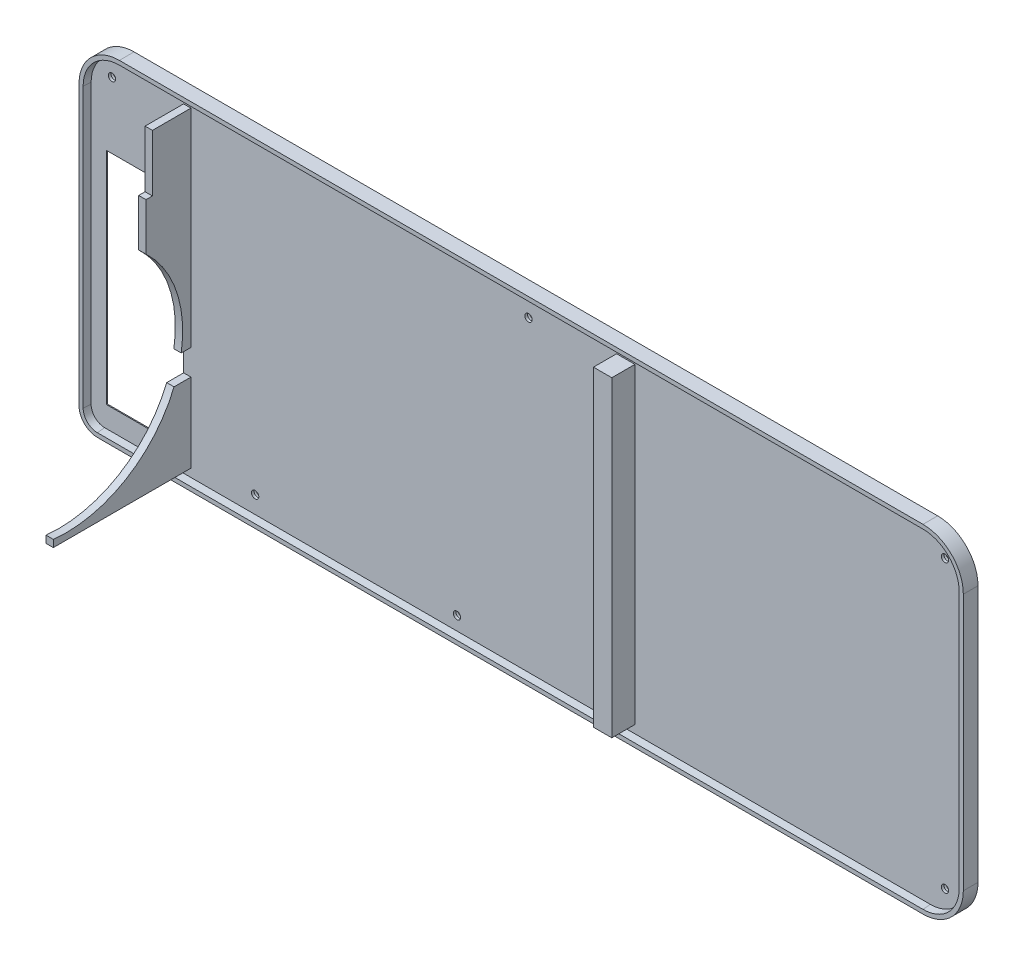
from build123d import *

# Parameters (mm, degrees)
SKETCH_1_W          = 241
SKETCH_1_H          = 92
EXTRUDE_1_DEPTH     = 2
FILLET_1_R          = 5
FILLET_2_R          = 11
CUT_EXTRUDE_1_REACH = 130.997
SKETCH_3_R          = 1
SKETCH_4_R          = 2
CUT_EXTRUDE_2_DEPTH = 1.3
EXTRUDE_START       = 2
EXTRUDE_2_DEPTH     = 2
CHAMFER_1_SIZE      = 0.174977327
CHAMFER_1_SIZE_2    = 2
SKETCH_6_W          = 5
SKETCH_6_H          = 85
EXTRUDE_3_DEPTH     = 6.3
CUT_EXTRUDE_3_REACH = 131.135
SKETCH_7_W          = 21
SKETCH_7_H          = 60
EXTRUDE_START_2     = -28.5
EXTRUDE_4_DEPTH     = 2
CHAMFER_2_SIZE      = 3
CHAMFER_2_SIZE2     = 1.732050808


with BuildPart() as part:
    # 草图1 → 凸台-拉伸1 (new body)
    with BuildSketch(Plane.XY):
        Rectangle(SKETCH_1_W, SKETCH_1_H)
    extrude(amount=EXTRUDE_1_DEPTH)

    # 圆角1
    fillet_1_edges = [part.edges().sort_by_distance(p)[0] for p in [
        (-120.5, -46, 1),
    ]]
    fillet(fillet_1_edges, radius=FILLET_1_R)

    # 圆角2
    fillet_2_edges = [part.edges().sort_by_distance(p)[0] for p in [
        (120.5, -46, 1),
        (-120.5, 46, 1),
        (120.5, 46, 1),
    ]]
    fillet(fillet_2_edges, radius=FILLET_2_R)

    # 草图3 → 切除-拉伸1 (cut, up to next)
    with BuildSketch(Plane.XY.offset(2), mode=Mode.PRIVATE) as cut_extrude_1_sk1:
        with Locations((-19.5, -41)):
            Circle(SKETCH_3_R)
    cut_extrude_1_tool1 = extrude(cut_extrude_1_sk1.sketch, amount=-CUT_EXTRUDE_1_REACH, mode=Mode.PRIVATE) & part.part
    # 草图3 → 切除-拉伸1 (cut, up to next)
    with BuildSketch(Plane.XY.offset(2), mode=Mode.PRIVATE) as cut_extrude_1_sk2:
        with Locations((-74.5, -40)):
            Circle(SKETCH_3_R)
    cut_extrude_1_tool2 = extrude(cut_extrude_1_sk2.sketch, amount=-CUT_EXTRUDE_1_REACH, mode=Mode.PRIVATE) & part.part
    # 草图3 → 切除-拉伸1 (cut, up to next)
    with BuildSketch(Plane.XY.offset(2), mode=Mode.PRIVATE) as cut_extrude_1_sk3:
        with Locations((-113.5, 39)):
            Circle(SKETCH_3_R)
    cut_extrude_1_tool3 = extrude(cut_extrude_1_sk3.sketch, amount=-CUT_EXTRUDE_1_REACH, mode=Mode.PRIVATE) & part.part
    # 草图3 → 切除-拉伸1 (cut, up to next)
    with BuildSketch(Plane.XY.offset(2), mode=Mode.PRIVATE) as cut_extrude_1_sk4:
        with Locations((0, 39)):
            Circle(SKETCH_3_R)
    cut_extrude_1_tool4 = extrude(cut_extrude_1_sk4.sketch, amount=-CUT_EXTRUDE_1_REACH, mode=Mode.PRIVATE) & part.part
    # 草图3 → 切除-拉伸1 (cut, up to next)
    with BuildSketch(Plane.XY.offset(2), mode=Mode.PRIVATE) as cut_extrude_1_sk5:
        with Locations((113.5, -39)):
            Circle(SKETCH_3_R)
    cut_extrude_1_tool5 = extrude(cut_extrude_1_sk5.sketch, amount=-CUT_EXTRUDE_1_REACH, mode=Mode.PRIVATE) & part.part
    # 草图3 → 切除-拉伸1 (cut, up to next)
    with BuildSketch(Plane.XY.offset(2), mode=Mode.PRIVATE) as cut_extrude_1_sk6:
        with Locations((113.5, 39)):
            Circle(SKETCH_3_R)
    cut_extrude_1_tool6 = extrude(cut_extrude_1_sk6.sketch, amount=-CUT_EXTRUDE_1_REACH, mode=Mode.PRIVATE) & part.part
    add(cut_extrude_1_tool1.solids().sort_by_distance((-19.5, -41, 2))[0], mode=Mode.SUBTRACT)
    add(cut_extrude_1_tool2.solids().sort_by_distance((-74.5, -40, 2))[0], mode=Mode.SUBTRACT)
    add(cut_extrude_1_tool3.solids().sort_by_distance((-113.5, 39, 2))[0], mode=Mode.SUBTRACT)
    add(cut_extrude_1_tool4.solids().sort_by_distance((0, 39, 2))[0], mode=Mode.SUBTRACT)
    add(cut_extrude_1_tool5.solids().sort_by_distance((113.5, -39, 2))[0], mode=Mode.SUBTRACT)
    add(cut_extrude_1_tool6.solids().sort_by_distance((113.5, 39, 2))[0], mode=Mode.SUBTRACT)

    # 草图4 → 切除-拉伸2 (cut)
    with BuildSketch(Plane(origin=(0, 0, 0), x_dir=(-1, 0, 0), z_dir=(0, 0, -1))):
        with Locations((74.5, -40)):
            Circle(SKETCH_4_R)
        with Locations((19.5, -41)):
            Circle(SKETCH_4_R)
        with Locations((-113.5, -39)):
            Circle(SKETCH_4_R)
        with Locations((-113.5, 39)):
            Circle(SKETCH_4_R)
        with Locations((0, 39)):
            Circle(SKETCH_4_R)
        with Locations((113.5, 39)):
            Circle(SKETCH_4_R)
    extrude(amount=-CUT_EXTRUDE_2_DEPTH, mode=Mode.SUBTRACT)

    # 草图5 → 凸台-拉伸2 (add)
    with BuildSketch(Plane.XY.offset(2).offset(EXTRUDE_START)):
        with BuildLine():
            ThreePointArc((-120.5, -41), (-119.035533906, -44.535533906), (-115.5, -46))
            Line((-115.5, -46), (109.5, -46))
            ThreePointArc((109.5, -46), (117.278174593, -42.778174593), (120.5, -35))
            Line((120.5, -35), (120.5, 35))
            ThreePointArc((120.5, 35), (117.278174593, 42.778174593), (109.5, 46))
            Line((109.5, 46), (-109.5, 46))
            ThreePointArc((-109.5, 46), (-117.278174593, 42.778174593), (-120.5, 35))
            Line((-120.5, 35), (-120.5, -41))
        make_face()
        with BuildLine():
            Line((109.5, -44.7), (-115.5, -44.7))
            ThreePointArc((-115.5, -44.7), (-118.11629509, -43.61629509), (-119.2, -41))
            Line((-119.2, -41), (-119.2, 35))
            ThreePointArc((-119.2, 35), (-116.358935778, 41.858935778), (-109.5, 44.7))
            Line((-109.5, 44.7), (109.5, 44.7))
            ThreePointArc((109.5, 44.7), (116.358935778, 41.858935778), (119.2, 35))
            Line((119.2, 35), (119.2, -35))
            ThreePointArc((119.2, -35), (116.358935778, -41.858935778), (109.5, -44.7))
        make_face(mode=Mode.SUBTRACT)
    extrude(amount=-EXTRUDE_2_DEPTH)

    # 倒角1
    # the kernel refuses this chamfer: 2, 0.174977327 mm, written as the material it takes off along each edge
    with BuildSketch(Plane(origin=(-109.5, 44.7, 4), x_dir=(0, 0.9159861691531133, 0.40120984275090293), z_dir=(1, 0, 0))) as chamfer_1_piece_1_section:
        Polygon((CHAMFER_1_SIZE * 0.915986169425, -CHAMFER_1_SIZE * 0.40120984287), (-CHAMFER_1_SIZE_2 * 0.401209842751, -CHAMFER_1_SIZE_2 * 0.915986169153), (0, 0), align=None)
    chamfer_1_piece_1 = extrude(amount=219, mode=Mode.PRIVATE)
    chamfer_1_piece_1 = split(chamfer_1_piece_1, bisect_by=Plane(origin=(0, 44.735649873, 2), z_dir=(0, 0, 1)), keep=Keep.TOP, mode=Mode.PRIVATE)
    add(chamfer_1_piece_1, mode=Mode.SUBTRACT)
    with BuildSketch(Plane(origin=(109.5, 35, 4), x_dir=(0, 1, 0), z_dir=(-1, 0, 0))) as chamfer_1_piece_2_section:
        Polygon((9.7 + CHAMFER_1_SIZE, 0), (9.7, CHAMFER_1_SIZE_2), (9.7, 0), align=None)
    chamfer_1_piece_2 = revolve(axis=Axis((109.5, 35, 4), (0, 0, -1)), revolution_arc=90, mode=Mode.PRIVATE)
    chamfer_1_piece_2 = split(chamfer_1_piece_2, bisect_by=Plane(origin=(116.41200817, 41.91200817, 2), z_dir=(0, 0, 1)), keep=Keep.TOP, mode=Mode.PRIVATE)
    add(chamfer_1_piece_2, mode=Mode.SUBTRACT)
    with BuildSketch(Plane(origin=(-109.5, 35, 4), x_dir=(-1, 0, 0), z_dir=(0, -1, 0))) as chamfer_1_piece_3_section:
        Polygon((9.7 + CHAMFER_1_SIZE, 0), (9.7, CHAMFER_1_SIZE_2), (9.7, 0), align=None)
    chamfer_1_piece_3 = revolve(axis=Axis((-109.5, 35, 4), (0, 0, -1)), revolution_arc=90, mode=Mode.PRIVATE)
    chamfer_1_piece_3 = split(chamfer_1_piece_3, bisect_by=Plane(origin=(-116.412008168, 41.912008168, 2), z_dir=(0, 0, 1)), keep=Keep.TOP, mode=Mode.PRIVATE)
    add(chamfer_1_piece_3, mode=Mode.SUBTRACT)
    with BuildSketch(Plane(origin=(119.2, 35, 4), x_dir=(0.9159861691531133, 0, 0.40120984275090293), z_dir=(0, -1, 0))) as chamfer_1_piece_4_section:
        Polygon((CHAMFER_1_SIZE * 0.915986169425, -CHAMFER_1_SIZE * 0.40120984287), (-CHAMFER_1_SIZE_2 * 0.401209842751, -CHAMFER_1_SIZE_2 * 0.915986169153), (0, 0), align=None)
    chamfer_1_piece_4 = extrude(amount=70, mode=Mode.PRIVATE)
    chamfer_1_piece_4 = split(chamfer_1_piece_4, bisect_by=Plane(origin=(119.235649873, 0, 2), z_dir=(0, 0, 1)), keep=Keep.TOP, mode=Mode.PRIVATE)
    add(chamfer_1_piece_4, mode=Mode.SUBTRACT)
    with BuildSketch(Plane(origin=(-119.2, -41, 4), x_dir=(-0.9159861691531133, 0, 0.40120984275090293), z_dir=(0, 1, 0))) as chamfer_1_piece_5_section:
        Polygon((CHAMFER_1_SIZE * 0.915986169425, -CHAMFER_1_SIZE * 0.40120984287), (-CHAMFER_1_SIZE_2 * 0.401209842751, -CHAMFER_1_SIZE_2 * 0.915986169153), (0, 0), align=None)
    chamfer_1_piece_5 = extrude(amount=76, mode=Mode.PRIVATE)
    chamfer_1_piece_5 = split(chamfer_1_piece_5, bisect_by=Plane(origin=(-119.235649873, -3, 2), z_dir=(0, 0, 1)), keep=Keep.TOP, mode=Mode.PRIVATE)
    add(chamfer_1_piece_5, mode=Mode.SUBTRACT)
    with BuildSketch(Plane(origin=(109.5, -35, 4), x_dir=(1, 0, 0), z_dir=(0, 1, 0))) as chamfer_1_piece_6_section:
        Polygon((9.7 + CHAMFER_1_SIZE, 0), (9.7, CHAMFER_1_SIZE_2), (9.7, 0), align=None)
    chamfer_1_piece_6 = revolve(axis=Axis((109.5, -35, 4), (0, 0, -1)), revolution_arc=90, mode=Mode.PRIVATE)
    chamfer_1_piece_6 = split(chamfer_1_piece_6, bisect_by=Plane(origin=(116.41200817, -41.91200817, 2), z_dir=(0, 0, 1)), keep=Keep.TOP, mode=Mode.PRIVATE)
    add(chamfer_1_piece_6, mode=Mode.SUBTRACT)
    with BuildSketch(Plane(origin=(-115.5, -41, 4), x_dir=(0, -1, 0), z_dir=(1, 0, 0))) as chamfer_1_piece_7_section:
        Polygon((3.7 + CHAMFER_1_SIZE, 0), (3.7, CHAMFER_1_SIZE_2), (3.7, 0), align=None)
    chamfer_1_piece_7 = revolve(axis=Axis((-115.5, -41, 4), (0, 0, -1)), revolution_arc=90, mode=Mode.PRIVATE)
    chamfer_1_piece_7 = split(chamfer_1_piece_7, bisect_by=Plane(origin=(-118.172444307, -43.672444307, 2), z_dir=(0, 0, 1)), keep=Keep.TOP, mode=Mode.PRIVATE)
    add(chamfer_1_piece_7, mode=Mode.SUBTRACT)
    with BuildSketch(Plane(origin=(109.5, -44.7, 4), x_dir=(0, -0.9159861691531133, 0.40120984275090293), z_dir=(-1, 0, 0))) as chamfer_1_piece_8_section:
        Polygon((CHAMFER_1_SIZE * 0.915986169425, -CHAMFER_1_SIZE * 0.40120984287), (-CHAMFER_1_SIZE_2 * 0.401209842751, -CHAMFER_1_SIZE_2 * 0.915986169153), (0, 0), align=None)
    chamfer_1_piece_8 = extrude(amount=225, mode=Mode.PRIVATE)
    chamfer_1_piece_8 = split(chamfer_1_piece_8, bisect_by=Plane(origin=(-3, -44.735649873, 2), z_dir=(0, 0, 1)), keep=Keep.TOP, mode=Mode.PRIVATE)
    add(chamfer_1_piece_8, mode=Mode.SUBTRACT)

    # 草图6 → 凸台-拉伸3 (add)
    with BuildSketch(Plane.XY.offset(2)):
        with Locations((26.5, 0)):
            Rectangle(SKETCH_6_W, SKETCH_6_H)
    extrude(amount=EXTRUDE_3_DEPTH)

    # 草图7 → 切除-拉伸3 (cut, up to next)
    with BuildSketch(Plane.XY.offset(2), mode=Mode.PRIVATE) as cut_extrude_3_sk1:
        with Locations((-104.5, -9)):
            Rectangle(SKETCH_7_W, SKETCH_7_H)
    cut_extrude_3_tool1 = extrude(cut_extrude_3_sk1.sketch, amount=-CUT_EXTRUDE_3_REACH, mode=Mode.PRIVATE) & part.part
    add(cut_extrude_3_tool1.solids().sort_by_distance((-104.5, -9, 2))[0], mode=Mode.SUBTRACT)

    # 草图8 → 凸台-拉伸4 (add)
    with BuildSketch(Plane.ZY.offset(120.5).offset(EXTRUDE_START_2)):
        with BuildLine():
            Line((2, -21), (2, -42.5))
            Line((2, -42.5), (39.5, -42.5))
            Line((39.5, -42.5), (39.5, -40.556496954))
            ThreePointArc((39.5, -40.556496954), (19.774984647, -36.291232599), (6.605059959, -21))
            Line((6.605059959, -21), (2, -21))
        make_face()
        with BuildLine():
            Line((2, -14), (4.646172482, -14))
            ThreePointArc((4.646172482, -14), (5.952882138, 1.25832385), (14.25, 14.130067012))
            Line((14.25, 14.130067012), (14.25, 27))
            Line((14.25, 27), (12.5, 27))
            Line((12.5, 27), (12.5, 42.479565739))
            Line((12.5, 42.479565739), (2, 42.479565739))
            Line((2, 42.479565739), (2, -14))
        make_face()
    extrude(amount=EXTRUDE_4_DEPTH)

    # 倒角2
    chamfer_2_edges = [part.edges().sort_by_distance(p)[0] for p in [
        (-104.5, -39, 0),
        (-115, -9, 0),
        (-104.5, 21, 0),
        (-94, -9, 0),
    ]]
    chamfer_2_side = [part.faces().sort_by_distance(p)[0] for p in [
        (6.21588018, 0.505356203, 0),
    ]]
    chamfer(chamfer_2_edges, length=CHAMFER_2_SIZE, length2=CHAMFER_2_SIZE2, reference=chamfer_2_side[0])


solid = part.part
